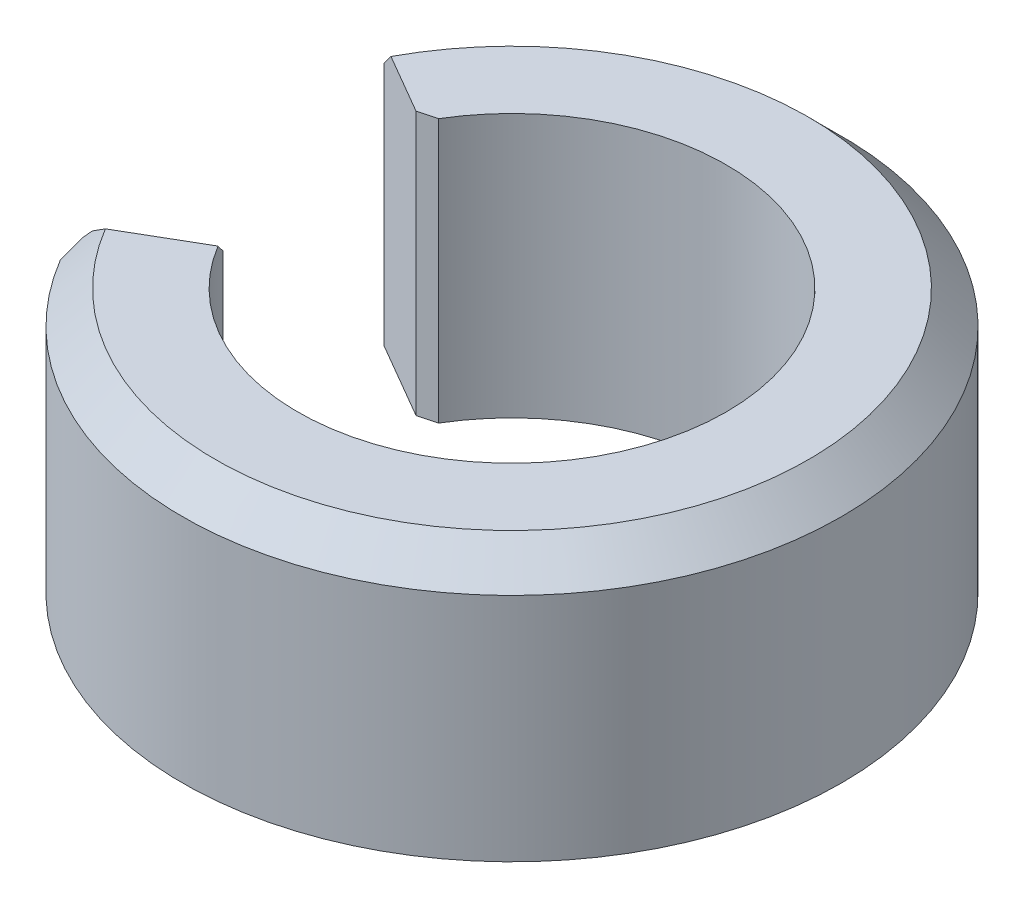
from build123d import *

# Parameters (mm, degrees)
BOSS_EXTRUDE1_DEPTH = 4
CHAMFER1_SIZE       = 0.2
CHAMFER1_SIZE_2     = 0.206341937
CHAMFER2_SIZE       = 0.5


with BuildPart() as part:
    # Sketch1 → Boss-Extrude1 (new body)
    with BuildSketch(Plane(origin=(0, 0, 0), x_dir=(1, 0, 0), z_dir=(0, 1, 0))):
        with BuildLine():
            ThreePointArc((5, 0), (1.227434059, 4.846999652), (-4.397362252, 2.379748983))
            Line((-4.397362252, 2.379748983), (-2.883140649, 1.5))
            ThreePointArc((-2.883140649, 1.5), (0.772105204, 3.156953207), (3.25, 0))
            ThreePointArc((3.25, 0), (0.772105204, -3.156953207), (-2.883140649, -1.5))
            Line((-2.883140649, -1.5), (-4.397362252, -2.379748983))
            ThreePointArc((-4.397362252, -2.379748983), (1.227434059, -4.846999652), (5, 0))
        make_face()
    extrude(amount=BOSS_EXTRUDE1_DEPTH)

    # Chamfer1
    # the kernel refuses this chamfer: 0.206341937, 0.2, 0.191297121 mm, written as the material it takes off along each edge
    with BuildSketch(Plane(origin=(-2.883140649, -0.514336598, -1.5), x_dir=(0.4881882615859918, 0, -0.8727383463843256), z_dir=(0, 1, 0))) as chamfer1_piece_1:
        with BuildLine():
            Line((0.196815803, 0), (CHAMFER1_SIZE * 0.0163116056584, CHAMFER1_SIZE * 0.99986695691))
            Line((CHAMFER1_SIZE * 0.0163116056584, CHAMFER1_SIZE * 0.99986695691), (0, 0))
            ThreePointArc((0, 0), (0.101193556, 0.001489012), (0.196815803, 0))
        make_face()
    extrude(amount=5.028673195, mode=Mode.SUBTRACT)
    with BuildSketch(Plane(origin=(-4.397362252, -0.531068819, -2.379748983), x_dir=(0.4931124519861111, 0, -0.8699655796042999), z_dir=(0, 1, 0))) as chamfer1_piece_2:
        with BuildLine():
            Line((0.196188757, 0), (-CHAMFER1_SIZE_2 * 0.010660935079, -CHAMFER1_SIZE_2 * 0.999943172174))
            Line((-CHAMFER1_SIZE_2 * 0.010660935079, -CHAMFER1_SIZE_2 * 0.999943172174), (0, 0))
            ThreePointArc((0, 0), (0.100953531, 0.000961526), (0.196188757, 0))
        make_face()
    extrude(amount=5.062137639, mode=Mode.SUBTRACT)
    with BuildSketch(Plane(origin=(-4.397362252, -0.520052168, 2.379748983), x_dir=(0.49362201920020077, 0, 0.8696765503109283), z_dir=(0, 1, 0))) as chamfer1_piece_3:
        with BuildLine():
            Line((0.202045895, 0), (-CHAMFER1_SIZE * 0.0100751366451, CHAMFER1_SIZE * 0.999949244523))
            Line((-CHAMFER1_SIZE * 0.0100751366451, CHAMFER1_SIZE * 0.999949244523), (0, 0))
            ThreePointArc((0, 0), (0.103969214, -0.0010198), (0.202045895, 0))
        make_face()
    extrude(amount=5.040104337, mode=Mode.SUBTRACT)
    # the kernel refuses this chamfer: 0.206341937, 0.2, 0.191297121 mm, written as the material it takes off along each edge
    with BuildSketch(Plane(origin=(-2.438414829, 4, 1.241618342), x_dir=(0.502359075260422, 0, 0.8646591001680913), z_dir=(-0.8646591001680914, 0, 0.502359075260422))) as chamfer1_2_piece_1:
        Polygon((CHAMFER1_SIZE, 0), (0, -CHAMFER1_SIZE), (0, 0), align=None)
    extrude(amount=2.57990857, mode=Mode.SUBTRACT)

    # Chamfer2
    # the kernel refuses this chamfer: 0.5 mm, written as the material it takes off along each edge
    with BuildSketch(Plane(origin=(0, 4, 0), x_dir=(-0.9618869269385497, 0, -0.2734475082803154), z_dir=(-0.2734475082803154, 0, 0.9618869269385497))) as chamfer2_piece_1:
        Polygon((5, CHAMFER2_SIZE), (5 - CHAMFER2_SIZE, 0), (5, 0), align=None)
    revolve(axis=Axis((0, 4, 0), (0, -1, 0)), revolution_arc=328.193834559, mode=Mode.SUBTRACT)


solid = part.part
